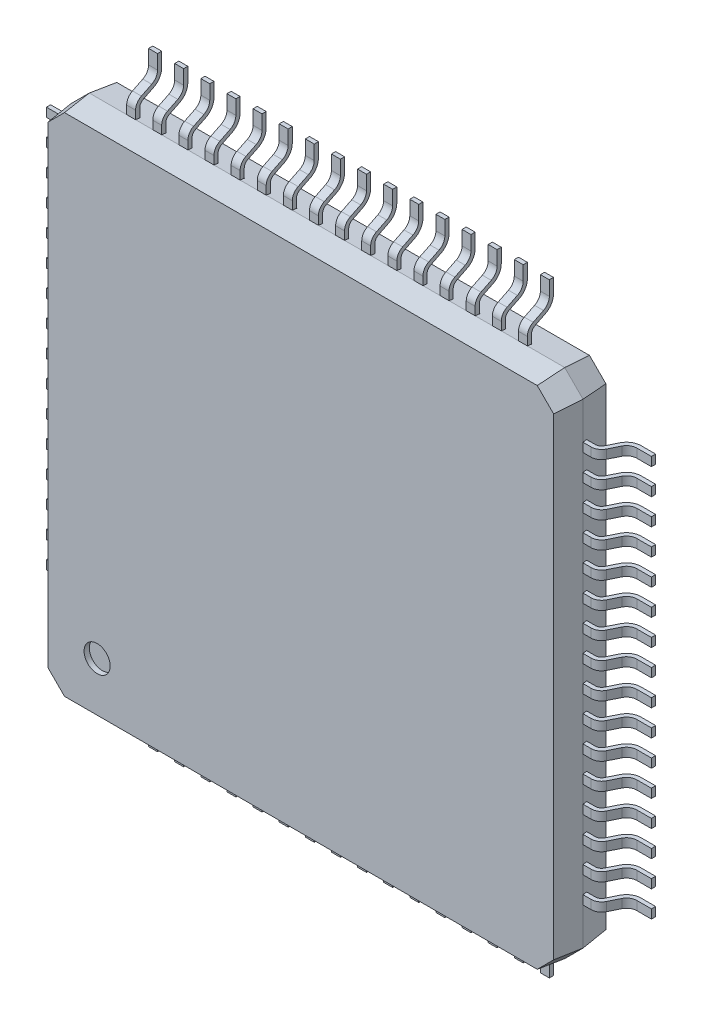
from build123d import *
from OCP.BRepFilletAPI import BRepFilletAPI_MakeChamfer

# Parameters (mm, degrees)
EXTRUDE1_DEPTH    = 1
CHAMFER1_SIZE     = 0.5
CHAMFER1_SIZE2    = 0.06139228
CHAMFER4_SIZE     = 0.06139228
CHAMFER4_SIZE_2   = 0.5
SKETCH2_R         = 0.25
EXTRUDE2_DEPTH    = 0.1
SKETCH4_W         = 0.17077336
SKETCH4_H         = 0.897354233
EXTRUDE3_DEPTH    = 0.5
EXTRUDE3_2_DEPTH  = 0.5
EXTRUDE3_3_DEPTH  = 0.5
EXTRUDE3_4_DEPTH  = 0.5
EXTRUDE3_5_DEPTH  = 0.5
EXTRUDE3_6_DEPTH  = 0.5
EXTRUDE3_7_DEPTH  = 0.5
EXTRUDE3_8_DEPTH  = 0.5
EXTRUDE3_9_DEPTH  = 0.5
EXTRUDE3_10_DEPTH = 0.5
EXTRUDE3_11_DEPTH = 0.5
EXTRUDE3_12_DEPTH = 0.5
EXTRUDE3_13_DEPTH = 0.5
EXTRUDE3_14_DEPTH = 0.5
EXTRUDE3_15_DEPTH = 0.5
SKETCH4_W_2       = 0.90104855
SKETCH4_H_2       = 0.17
EXTRUDE3_16_DEPTH = 0.5
EXTRUDE3_17_DEPTH = 0.5
EXTRUDE3_18_DEPTH = 0.5
EXTRUDE3_19_DEPTH = 0.5
EXTRUDE3_20_DEPTH = 0.5
EXTRUDE3_21_DEPTH = 0.5
EXTRUDE3_22_DEPTH = 0.5
EXTRUDE3_23_DEPTH = 0.5
EXTRUDE3_24_DEPTH = 0.5
EXTRUDE3_25_DEPTH = 0.5
EXTRUDE3_26_DEPTH = 0.5
EXTRUDE3_27_DEPTH = 0.5
EXTRUDE3_28_DEPTH = 0.5
EXTRUDE3_29_DEPTH = 0.5
EXTRUDE3_30_DEPTH = 0.5
EXTRUDE3_31_DEPTH = 0.5
EXTRUDE3_32_DEPTH = 0.5
EXTRUDE3_33_DEPTH = 0.5
EXTRUDE3_34_DEPTH = 0.5
EXTRUDE3_35_DEPTH = 0.5
EXTRUDE3_36_DEPTH = 0.5
EXTRUDE3_37_DEPTH = 0.5
EXTRUDE3_38_DEPTH = 0.5
EXTRUDE3_39_DEPTH = 0.5
EXTRUDE3_40_DEPTH = 0.5
EXTRUDE3_41_DEPTH = 0.5
EXTRUDE3_42_DEPTH = 0.5
EXTRUDE3_43_DEPTH = 0.5
EXTRUDE3_44_DEPTH = 0.5
EXTRUDE3_45_DEPTH = 0.5
EXTRUDE3_46_DEPTH = 0.5
EXTRUDE3_47_DEPTH = 0.5
EXTRUDE3_48_DEPTH = 0.5
EXTRUDE3_49_DEPTH = 0.5
EXTRUDE3_50_DEPTH = 0.5
EXTRUDE3_51_DEPTH = 0.5
EXTRUDE3_52_DEPTH = 0.5
EXTRUDE3_53_DEPTH = 0.5
EXTRUDE3_54_DEPTH = 0.5
EXTRUDE3_55_DEPTH = 0.5
EXTRUDE3_56_DEPTH = 0.5
EXTRUDE3_57_DEPTH = 0.5
EXTRUDE3_58_DEPTH = 0.5
EXTRUDE3_59_DEPTH = 0.5
EXTRUDE3_60_DEPTH = 0.5
EXTRUDE3_61_DEPTH = 0.5
EXTRUDE3_62_DEPTH = 0.5
EXTRUDE3_63_DEPTH = 0.5
EXTRUDE3_64_DEPTH = 0.5
EXTRUDE9_DEPTH    = 12.276959755
EXTRUDE10_DEPTH   = 12.274237102
EXTRUDE11_DEPTH   = 12.276959755
EXTRUDE12_DEPTH   = 12.275731544


with BuildPart() as part:
    # Sketch1 → Extrude1 (new body)
    with BuildSketch(Plane.XY):
        Polygon((-4.55, 4.9), (-4.9, 4.55), (-4.9, -4.55), (-4.55, -4.9), (4.55, -4.9), (4.9, -4.55), (4.9, 4.55), (4.55, 4.9), align=None)
    extrude(amount=EXTRUDE1_DEPTH)

    # Chamfer1: one chamfer whose edges measure the first distance from different faces: ONE call of the kernel's chamfer builder (chamfer() names one face for all edges)
    chamfer1_edges_1 = [part.edges().sort_by_distance(p)[0] for p in [
        (0, -4.9, 1),
    ]]
    chamfer1_side_1 = [part.faces().sort_by_distance(p)[0] for p in [
        (0, -4.9, 0.5),
    ]]
    chamfer1_edges_2 = [part.edges().sort_by_distance(p)[0] for p in [
        (4.725, -4.725, 1),
    ]]
    chamfer1_side_2 = [part.faces().sort_by_distance(p)[0] for p in [
        (4.725, -4.725, 0.5),
    ]]
    chamfer1_edges_3 = [part.edges().sort_by_distance(p)[0] for p in [
        (4.9, 0, 1),
    ]]
    chamfer1_side_3 = [part.faces().sort_by_distance(p)[0] for p in [
        (4.9, 0, 0.5),
    ]]
    chamfer1_edges_4 = [part.edges().sort_by_distance(p)[0] for p in [
        (4.725, 4.725, 1),
    ]]
    chamfer1_side_4 = [part.faces().sort_by_distance(p)[0] for p in [
        (4.725, 4.725, 0.5),
    ]]
    chamfer1_edges_5 = [part.edges().sort_by_distance(p)[0] for p in [
        (0, 4.9, 1),
    ]]
    chamfer1_side_5 = [part.faces().sort_by_distance(p)[0] for p in [
        (0, 4.9, 0.5),
    ]]
    chamfer1_edges_6 = [part.edges().sort_by_distance(p)[0] for p in [
        (-4.725, 4.725, 1),
    ]]
    chamfer1_side_6 = [part.faces().sort_by_distance(p)[0] for p in [
        (-4.725, 4.725, 0.5),
    ]]
    chamfer1_edges_7 = [part.edges().sort_by_distance(p)[0] for p in [
        (-4.9, 0, 1),
    ]]
    chamfer1_side_7 = [part.faces().sort_by_distance(p)[0] for p in [
        (-4.9, 0, 0.5),
    ]]
    chamfer1_edges_8 = [part.edges().sort_by_distance(p)[0] for p in [
        (-4.725, -4.725, 1),
    ]]
    chamfer1_side_8 = [part.faces().sort_by_distance(p)[0] for p in [
        (-4.725, -4.725, 0.5),
    ]]
    chamfer1 = BRepFilletAPI_MakeChamfer(part.part.solid().wrapped)
    for e in chamfer1_edges_1:
        chamfer1.Add(CHAMFER1_SIZE, CHAMFER1_SIZE2, e.wrapped, chamfer1_side_1[0].wrapped)  # the first distance lies on this face
    for e in chamfer1_edges_2:
        chamfer1.Add(CHAMFER1_SIZE, CHAMFER1_SIZE2, e.wrapped, chamfer1_side_2[0].wrapped)  # the first distance lies on this face
    for e in chamfer1_edges_3:
        chamfer1.Add(CHAMFER1_SIZE, CHAMFER1_SIZE2, e.wrapped, chamfer1_side_3[0].wrapped)  # the first distance lies on this face
    for e in chamfer1_edges_4:
        chamfer1.Add(CHAMFER1_SIZE, CHAMFER1_SIZE2, e.wrapped, chamfer1_side_4[0].wrapped)  # the first distance lies on this face
    for e in chamfer1_edges_5:
        chamfer1.Add(CHAMFER1_SIZE, CHAMFER1_SIZE2, e.wrapped, chamfer1_side_5[0].wrapped)  # the first distance lies on this face
    for e in chamfer1_edges_6:
        chamfer1.Add(CHAMFER1_SIZE, CHAMFER1_SIZE2, e.wrapped, chamfer1_side_6[0].wrapped)  # the first distance lies on this face
    for e in chamfer1_edges_7:
        chamfer1.Add(CHAMFER1_SIZE, CHAMFER1_SIZE2, e.wrapped, chamfer1_side_7[0].wrapped)  # the first distance lies on this face
    for e in chamfer1_edges_8:
        chamfer1.Add(CHAMFER1_SIZE, CHAMFER1_SIZE2, e.wrapped, chamfer1_side_8[0].wrapped)  # the first distance lies on this face
    add(Compound.cast(chamfer1.Shape()), mode=Mode.REPLACE)

    # Chamfer4
    # the kernel refuses this chamfer: 0.5, 0.06139228 mm, written as the material it takes off along each edge
    with BuildSketch(Plane(origin=(3.631014617, -5.818985383, 0), x_dir=(-0.6752072893443284, 0.6752072893443284, -0.29696840376135786), z_dir=(0.7071067811865476, 0.7071067811865476, 0)), Plane(origin=(5.818985383, 3.631014617, 0), x_dir=(-0.6752072893443284, -0.6752072893443284, -0.29696840376135786), z_dir=(-0.7071067811865476, 0.7071067811865476, 0)), Plane(origin=(-5.818985383, -3.631014617, 0), x_dir=(0.6752072893443284, 0.6752072893443284, -0.29696840376135786), z_dir=(0.7071067811865476, -0.7071067811865476, 0))) as chamfer4_piece_1:
        Polygon((CHAMFER4_SIZE * 0.954887313026, CHAMFER4_SIZE * 0.296968405945), (-CHAMFER4_SIZE_2 * 0.296968403761, CHAMFER4_SIZE_2 * 0.954887306004), (0, 0), align=None)
    extrude(amount=3.094257932, mode=Mode.SUBTRACT)
    with BuildSketch(Plane(origin=(4.9, -5.849641592, 0), x_dir=(-0.9548873060039249, 0, -0.2969684037613545), z_dir=(0, 1, 0)), Plane(origin=(-5.849641592, -4.9, 0), x_dir=(0, 0.9548873060039249, -0.2969684037613545), z_dir=(1, 0, 0)), Plane(origin=(-4.9, 5.849641592, 0), x_dir=(0.9548873060039249, 0, -0.2969684037613545), z_dir=(0, -1, 0))) as chamfer4_piece_2:
        Polygon((CHAMFER4_SIZE * 0.954887313026, CHAMFER4_SIZE * 0.296968405945), (-CHAMFER4_SIZE_2 * 0.296968403761, CHAMFER4_SIZE_2 * 0.954887306004), (0, 0), align=None)
    extrude(amount=11.699283185, mode=Mode.SUBTRACT)
    with BuildSketch(Plane(origin=(5.849641592, 4.9, 0), x_dir=(0, 0.004688575069791615, 0.9999890085715017), z_dir=(-1, 0, 0))) as chamfer4_piece_3:
        Polygon((CHAMFER4_SIZE_2 * 0.999989008572, -CHAMFER4_SIZE_2 * 0.00468857506979), (-CHAMFER4_SIZE * 0.00468857510427, -CHAMFER4_SIZE * 0.999989015925), (0, 0), align=None)
    extrude(amount=11.699283185, mode=Mode.SUBTRACT)
    with BuildSketch(Plane(origin=(-3.631014617, 5.818985383, 0), x_dir=(-0.0033153232259505567, 0.0033153232259505567, 0.9999890085715017), z_dir=(-0.7071067811865476, -0.7071067811865476, 0))) as chamfer4_piece_4:
        Polygon((CHAMFER4_SIZE_2 * 0.999989008572, -CHAMFER4_SIZE_2 * 0.00468857506979), (-CHAMFER4_SIZE * 0.00468857510427, -CHAMFER4_SIZE * 0.999989015925), (0, 0), align=None)
    extrude(amount=3.094257932, mode=Mode.SUBTRACT)

    # Sketch2 → Extrude2 (cut)
    with BuildSketch(Plane.XY.offset(1)):
        with Locations((-3.9, -3.9)):
            Circle(SKETCH2_R)
    extrude(amount=-EXTRUDE2_DEPTH, mode=Mode.SUBTRACT)


with BuildPart() as body_2:
    # Sketch4 → Extrude3 (new body)
    with BuildSketch(Plane(origin=(0, 0, 0), x_dir=(-1, 0, 0), z_dir=(0, 0, -1))):
        with Locations((-3.25038668, -5.338577123)):
            Rectangle(SKETCH4_W, SKETCH4_H)
    extrude(amount=-EXTRUDE3_DEPTH)


with BuildPart() as body_3:
    # Sketch4 → Extrude3 2 (new body)
    with BuildSketch(Plane(origin=(0, 0, 0), x_dir=(-1, 0, 0), z_dir=(0, 0, -1))):
        with Locations((-2.75038668, -5.338577123)):
            Rectangle(SKETCH4_W, SKETCH4_H)
    extrude(amount=-EXTRUDE3_2_DEPTH)


with BuildPart() as body_4:
    # Sketch4 → Extrude3 3 (new body)
    with BuildSketch(Plane(origin=(0, 0, 0), x_dir=(-1, 0, 0), z_dir=(0, 0, -1))):
        with Locations((-2.25038668, -5.338577123)):
            Rectangle(SKETCH4_W, SKETCH4_H)
    extrude(amount=-EXTRUDE3_3_DEPTH)


with BuildPart() as body_5:
    # Sketch4 → Extrude3 4 (new body)
    with BuildSketch(Plane(origin=(0, 0, 0), x_dir=(-1, 0, 0), z_dir=(0, 0, -1))):
        with Locations((-1.75038668, -5.338577123)):
            Rectangle(SKETCH4_W, SKETCH4_H)
    extrude(amount=-EXTRUDE3_4_DEPTH)


with BuildPart() as body_6:
    # Sketch4 → Extrude3 5 (new body)
    with BuildSketch(Plane(origin=(0, 0, 0), x_dir=(-1, 0, 0), z_dir=(0, 0, -1))):
        with Locations((-1.25038668, -5.338577123)):
            Rectangle(SKETCH4_W, SKETCH4_H)
    extrude(amount=-EXTRUDE3_5_DEPTH)


with BuildPart() as body_7:
    # Sketch4 → Extrude3 6 (new body)
    with BuildSketch(Plane(origin=(0, 0, 0), x_dir=(-1, 0, 0), z_dir=(0, 0, -1))):
        with Locations((-0.75038668, -5.338577123)):
            Rectangle(SKETCH4_W, SKETCH4_H)
    extrude(amount=-EXTRUDE3_6_DEPTH)


with BuildPart() as body_8:
    # Sketch4 → Extrude3 7 (new body)
    with BuildSketch(Plane(origin=(0, 0, 0), x_dir=(-1, 0, 0), z_dir=(0, 0, -1))):
        with Locations((-0.25038668, -5.338577123)):
            Rectangle(SKETCH4_W, SKETCH4_H)
    extrude(amount=-EXTRUDE3_7_DEPTH)


with BuildPart() as body_9:
    # Sketch4 → Extrude3 8 (new body)
    with BuildSketch(Plane(origin=(0, 0, 0), x_dir=(-1, 0, 0), z_dir=(0, 0, -1))):
        with Locations((0.24961332, -5.338577123)):
            Rectangle(SKETCH4_W, SKETCH4_H)
    extrude(amount=-EXTRUDE3_8_DEPTH)


with BuildPart() as body_10:
    # Sketch4 → Extrude3 9 (new body)
    with BuildSketch(Plane(origin=(0, 0, 0), x_dir=(-1, 0, 0), z_dir=(0, 0, -1))):
        with Locations((0.74961332, -5.338577123)):
            Rectangle(SKETCH4_W, SKETCH4_H)
    extrude(amount=-EXTRUDE3_9_DEPTH)


with BuildPart() as body_11:
    # Sketch4 → Extrude3 10 (new body)
    with BuildSketch(Plane(origin=(0, 0, 0), x_dir=(-1, 0, 0), z_dir=(0, 0, -1))):
        with Locations((1.24961332, -5.338577123)):
            Rectangle(SKETCH4_W, SKETCH4_H)
    extrude(amount=-EXTRUDE3_10_DEPTH)


with BuildPart() as body_12:
    # Sketch4 → Extrude3 11 (new body)
    with BuildSketch(Plane(origin=(0, 0, 0), x_dir=(-1, 0, 0), z_dir=(0, 0, -1))):
        with Locations((1.74961332, -5.338577123)):
            Rectangle(SKETCH4_W, SKETCH4_H)
    extrude(amount=-EXTRUDE3_11_DEPTH)


with BuildPart() as body_13:
    # Sketch4 → Extrude3 12 (new body)
    with BuildSketch(Plane(origin=(0, 0, 0), x_dir=(-1, 0, 0), z_dir=(0, 0, -1))):
        with Locations((2.24961332, -5.338577123)):
            Rectangle(SKETCH4_W, SKETCH4_H)
    extrude(amount=-EXTRUDE3_12_DEPTH)


with BuildPart() as body_14:
    # Sketch4 → Extrude3 13 (new body)
    with BuildSketch(Plane(origin=(0, 0, 0), x_dir=(-1, 0, 0), z_dir=(0, 0, -1))):
        with Locations((2.74961332, -5.338577123)):
            Rectangle(SKETCH4_W, SKETCH4_H)
    extrude(amount=-EXTRUDE3_13_DEPTH)


with BuildPart() as body_15:
    # Sketch4 → Extrude3 14 (new body)
    with BuildSketch(Plane(origin=(0, 0, 0), x_dir=(-1, 0, 0), z_dir=(0, 0, -1))):
        with Locations((3.24961332, -5.338577123)):
            Rectangle(SKETCH4_W, SKETCH4_H)
    extrude(amount=-EXTRUDE3_14_DEPTH)


with BuildPart() as body_16:
    # Sketch4 → Extrude3 15 (new body)
    with BuildSketch(Plane(origin=(0, 0, 0), x_dir=(-1, 0, 0), z_dir=(0, 0, -1))):
        with Locations((3.74961332, -5.338577123)):
            Rectangle(SKETCH4_W, SKETCH4_H)
    extrude(amount=-EXTRUDE3_15_DEPTH)


with BuildPart() as body_17:
    # Sketch4 → Extrude3 16 (new body)
    with BuildSketch(Plane(origin=(0, 0, 0), x_dir=(-1, 0, 0), z_dir=(0, 0, -1))):
        with Locations((5.340581475, -3.249093841)):
            Rectangle(SKETCH4_W_2, SKETCH4_H_2)
    extrude(amount=-EXTRUDE3_16_DEPTH)


with BuildPart() as body_18:
    # Sketch4 → Extrude3 17 (new body)
    with BuildSketch(Plane(origin=(0, 0, 0), x_dir=(-1, 0, 0), z_dir=(0, 0, -1))):
        with Locations((-3.75038668, -5.338577123)):
            Rectangle(SKETCH4_W, SKETCH4_H)
    extrude(amount=-EXTRUDE3_17_DEPTH)


with BuildPart() as body_19:
    # Sketch4 → Extrude3 18 (new body)
    with BuildSketch(Plane(origin=(0, 0, 0), x_dir=(-1, 0, 0), z_dir=(0, 0, -1))):
        with Locations((5.340581475, -2.749093841)):
            Rectangle(SKETCH4_W_2, SKETCH4_H_2)
    extrude(amount=-EXTRUDE3_18_DEPTH)


with BuildPart() as body_20:
    # Sketch4 → Extrude3 19 (new body)
    with BuildSketch(Plane(origin=(0, 0, 0), x_dir=(-1, 0, 0), z_dir=(0, 0, -1))):
        with Locations((5.340581475, -2.249093841)):
            Rectangle(SKETCH4_W_2, SKETCH4_H_2)
    extrude(amount=-EXTRUDE3_19_DEPTH)


with BuildPart() as body_21:
    # Sketch4 → Extrude3 20 (new body)
    with BuildSketch(Plane(origin=(0, 0, 0), x_dir=(-1, 0, 0), z_dir=(0, 0, -1))):
        with Locations((5.340581475, -1.749093841)):
            Rectangle(SKETCH4_W_2, SKETCH4_H_2)
    extrude(amount=-EXTRUDE3_20_DEPTH)


with BuildPart() as body_22:
    # Sketch4 → Extrude3 21 (new body)
    with BuildSketch(Plane(origin=(0, 0, 0), x_dir=(-1, 0, 0), z_dir=(0, 0, -1))):
        with Locations((5.340581475, -1.249093841)):
            Rectangle(SKETCH4_W_2, SKETCH4_H_2)
    extrude(amount=-EXTRUDE3_21_DEPTH)


with BuildPart() as body_23:
    # Sketch4 → Extrude3 22 (new body)
    with BuildSketch(Plane(origin=(0, 0, 0), x_dir=(-1, 0, 0), z_dir=(0, 0, -1))):
        with Locations((5.340581475, -0.749093841)):
            Rectangle(SKETCH4_W_2, SKETCH4_H_2)
    extrude(amount=-EXTRUDE3_22_DEPTH)


with BuildPart() as body_24:
    # Sketch4 → Extrude3 23 (new body)
    with BuildSketch(Plane(origin=(0, 0, 0), x_dir=(-1, 0, 0), z_dir=(0, 0, -1))):
        with Locations((5.340581475, -0.249093841)):
            Rectangle(SKETCH4_W_2, SKETCH4_H_2)
    extrude(amount=-EXTRUDE3_23_DEPTH)


with BuildPart() as body_25:
    # Sketch4 → Extrude3 24 (new body)
    with BuildSketch(Plane(origin=(0, 0, 0), x_dir=(-1, 0, 0), z_dir=(0, 0, -1))):
        with Locations((5.340581475, 0.250906159)):
            Rectangle(SKETCH4_W_2, SKETCH4_H_2)
    extrude(amount=-EXTRUDE3_24_DEPTH)


with BuildPart() as body_26:
    # Sketch4 → Extrude3 25 (new body)
    with BuildSketch(Plane(origin=(0, 0, 0), x_dir=(-1, 0, 0), z_dir=(0, 0, -1))):
        with Locations((5.340581475, 0.750906159)):
            Rectangle(SKETCH4_W_2, SKETCH4_H_2)
    extrude(amount=-EXTRUDE3_25_DEPTH)


with BuildPart() as body_27:
    # Sketch4 → Extrude3 26 (new body)
    with BuildSketch(Plane(origin=(0, 0, 0), x_dir=(-1, 0, 0), z_dir=(0, 0, -1))):
        with Locations((5.340581475, 1.250906159)):
            Rectangle(SKETCH4_W_2, SKETCH4_H_2)
    extrude(amount=-EXTRUDE3_26_DEPTH)


with BuildPart() as body_28:
    # Sketch4 → Extrude3 27 (new body)
    with BuildSketch(Plane(origin=(0, 0, 0), x_dir=(-1, 0, 0), z_dir=(0, 0, -1))):
        with Locations((5.340581475, 1.750906159)):
            Rectangle(SKETCH4_W_2, SKETCH4_H_2)
    extrude(amount=-EXTRUDE3_27_DEPTH)


with BuildPart() as body_29:
    # Sketch4 → Extrude3 28 (new body)
    with BuildSketch(Plane(origin=(0, 0, 0), x_dir=(-1, 0, 0), z_dir=(0, 0, -1))):
        with Locations((5.340581475, 2.250906159)):
            Rectangle(SKETCH4_W_2, SKETCH4_H_2)
    extrude(amount=-EXTRUDE3_28_DEPTH)


with BuildPart() as body_30:
    # Sketch4 → Extrude3 29 (new body)
    with BuildSketch(Plane(origin=(0, 0, 0), x_dir=(-1, 0, 0), z_dir=(0, 0, -1))):
        with Locations((5.340581475, 2.750906159)):
            Rectangle(SKETCH4_W_2, SKETCH4_H_2)
    extrude(amount=-EXTRUDE3_29_DEPTH)


with BuildPart() as body_31:
    # Sketch4 → Extrude3 30 (new body)
    with BuildSketch(Plane(origin=(0, 0, 0), x_dir=(-1, 0, 0), z_dir=(0, 0, -1))):
        with Locations((5.340581475, 3.250906159)):
            Rectangle(SKETCH4_W_2, SKETCH4_H_2)
    extrude(amount=-EXTRUDE3_30_DEPTH)


with BuildPart() as body_32:
    # Sketch4 → Extrude3 31 (new body)
    with BuildSketch(Plane(origin=(0, 0, 0), x_dir=(-1, 0, 0), z_dir=(0, 0, -1))):
        with Locations((5.340581475, 3.750906159)):
            Rectangle(SKETCH4_W_2, SKETCH4_H_2)
    extrude(amount=-EXTRUDE3_31_DEPTH)


with BuildPart() as body_33:
    # Sketch4 → Extrude3 32 (new body)
    with BuildSketch(Plane(origin=(0, 0, 0), x_dir=(-1, 0, 0), z_dir=(0, 0, -1))):
        with Locations((-3.25038668, 5.338638318)):
            Rectangle(SKETCH4_W, SKETCH4_H)
    extrude(amount=-EXTRUDE3_32_DEPTH)


with BuildPart() as body_34:
    # Sketch4 → Extrude3 33 (new body)
    with BuildSketch(Plane(origin=(0, 0, 0), x_dir=(-1, 0, 0), z_dir=(0, 0, -1))):
        with Locations((-3.75038668, 5.338638318)):
            Rectangle(SKETCH4_W, SKETCH4_H)
    extrude(amount=-EXTRUDE3_33_DEPTH)


with BuildPart() as body_35:
    # Sketch4 → Extrude3 34 (new body)
    with BuildSketch(Plane(origin=(0, 0, 0), x_dir=(-1, 0, 0), z_dir=(0, 0, -1))):
        with Locations((-2.75038668, 5.338638318)):
            Rectangle(SKETCH4_W, SKETCH4_H)
    extrude(amount=-EXTRUDE3_34_DEPTH)


with BuildPart() as body_36:
    # Sketch4 → Extrude3 35 (new body)
    with BuildSketch(Plane(origin=(0, 0, 0), x_dir=(-1, 0, 0), z_dir=(0, 0, -1))):
        with Locations((-2.25038668, 5.338638318)):
            Rectangle(SKETCH4_W, SKETCH4_H)
    extrude(amount=-EXTRUDE3_35_DEPTH)


with BuildPart() as body_37:
    # Sketch4 → Extrude3 36 (new body)
    with BuildSketch(Plane(origin=(0, 0, 0), x_dir=(-1, 0, 0), z_dir=(0, 0, -1))):
        with Locations((-1.75038668, 5.338638318)):
            Rectangle(SKETCH4_W, SKETCH4_H)
    extrude(amount=-EXTRUDE3_36_DEPTH)


with BuildPart() as body_38:
    # Sketch4 → Extrude3 37 (new body)
    with BuildSketch(Plane(origin=(0, 0, 0), x_dir=(-1, 0, 0), z_dir=(0, 0, -1))):
        with Locations((-1.25038668, 5.338638318)):
            Rectangle(SKETCH4_W, SKETCH4_H)
    extrude(amount=-EXTRUDE3_37_DEPTH)


with BuildPart() as body_39:
    # Sketch4 → Extrude3 38 (new body)
    with BuildSketch(Plane(origin=(0, 0, 0), x_dir=(-1, 0, 0), z_dir=(0, 0, -1))):
        with Locations((-0.75038668, 5.338638318)):
            Rectangle(SKETCH4_W, SKETCH4_H)
    extrude(amount=-EXTRUDE3_38_DEPTH)


with BuildPart() as body_40:
    # Sketch4 → Extrude3 39 (new body)
    with BuildSketch(Plane(origin=(0, 0, 0), x_dir=(-1, 0, 0), z_dir=(0, 0, -1))):
        with Locations((-0.25038668, 5.338638318)):
            Rectangle(SKETCH4_W, SKETCH4_H)
    extrude(amount=-EXTRUDE3_39_DEPTH)


with BuildPart() as body_41:
    # Sketch4 → Extrude3 40 (new body)
    with BuildSketch(Plane(origin=(0, 0, 0), x_dir=(-1, 0, 0), z_dir=(0, 0, -1))):
        with Locations((0.24961332, 5.338638318)):
            Rectangle(SKETCH4_W, SKETCH4_H)
    extrude(amount=-EXTRUDE3_40_DEPTH)


with BuildPart() as body_42:
    # Sketch4 → Extrude3 41 (new body)
    with BuildSketch(Plane(origin=(0, 0, 0), x_dir=(-1, 0, 0), z_dir=(0, 0, -1))):
        with Locations((0.74961332, 5.338638318)):
            Rectangle(SKETCH4_W, SKETCH4_H)
    extrude(amount=-EXTRUDE3_41_DEPTH)


with BuildPart() as body_43:
    # Sketch4 → Extrude3 42 (new body)
    with BuildSketch(Plane(origin=(0, 0, 0), x_dir=(-1, 0, 0), z_dir=(0, 0, -1))):
        with Locations((1.24961332, 5.338638318)):
            Rectangle(SKETCH4_W, SKETCH4_H)
    extrude(amount=-EXTRUDE3_42_DEPTH)


with BuildPart() as body_44:
    # Sketch4 → Extrude3 43 (new body)
    with BuildSketch(Plane(origin=(0, 0, 0), x_dir=(-1, 0, 0), z_dir=(0, 0, -1))):
        with Locations((1.74961332, 5.338638318)):
            Rectangle(SKETCH4_W, SKETCH4_H)
    extrude(amount=-EXTRUDE3_43_DEPTH)


with BuildPart() as body_45:
    # Sketch4 → Extrude3 44 (new body)
    with BuildSketch(Plane(origin=(0, 0, 0), x_dir=(-1, 0, 0), z_dir=(0, 0, -1))):
        with Locations((2.24961332, 5.338638318)):
            Rectangle(SKETCH4_W, SKETCH4_H)
    extrude(amount=-EXTRUDE3_44_DEPTH)


with BuildPart() as body_46:
    # Sketch4 → Extrude3 45 (new body)
    with BuildSketch(Plane(origin=(0, 0, 0), x_dir=(-1, 0, 0), z_dir=(0, 0, -1))):
        with Locations((2.74961332, 5.338638318)):
            Rectangle(SKETCH4_W, SKETCH4_H)
    extrude(amount=-EXTRUDE3_45_DEPTH)


with BuildPart() as body_47:
    # Sketch4 → Extrude3 46 (new body)
    with BuildSketch(Plane(origin=(0, 0, 0), x_dir=(-1, 0, 0), z_dir=(0, 0, -1))):
        with Locations((3.24961332, 5.338638318)):
            Rectangle(SKETCH4_W, SKETCH4_H)
    extrude(amount=-EXTRUDE3_46_DEPTH)


with BuildPart() as body_48:
    # Sketch4 → Extrude3 47 (new body)
    with BuildSketch(Plane(origin=(0, 0, 0), x_dir=(-1, 0, 0), z_dir=(0, 0, -1))):
        with Locations((3.74961332, 5.338638318)):
            Rectangle(SKETCH4_W, SKETCH4_H)
    extrude(amount=-EXTRUDE3_47_DEPTH)


with BuildPart() as body_49:
    # Sketch4 → Extrude3 48 (new body)
    with BuildSketch(Plane(origin=(0, 0, 0), x_dir=(-1, 0, 0), z_dir=(0, 0, -1))):
        with Locations((-5.339418525, -3.249093841)):
            Rectangle(SKETCH4_W_2, SKETCH4_H_2)
    extrude(amount=-EXTRUDE3_48_DEPTH)


with BuildPart() as body_50:
    # Sketch4 → Extrude3 49 (new body)
    with BuildSketch(Plane(origin=(0, 0, 0), x_dir=(-1, 0, 0), z_dir=(0, 0, -1))):
        with Locations((-5.339418525, -2.749093841)):
            Rectangle(SKETCH4_W_2, SKETCH4_H_2)
    extrude(amount=-EXTRUDE3_49_DEPTH)


with BuildPart() as body_51:
    # Sketch4 → Extrude3 50 (new body)
    with BuildSketch(Plane(origin=(0, 0, 0), x_dir=(-1, 0, 0), z_dir=(0, 0, -1))):
        with Locations((5.340581475, -3.749093841)):
            Rectangle(SKETCH4_W_2, SKETCH4_H_2)
    extrude(amount=-EXTRUDE3_50_DEPTH)


with BuildPart() as body_52:
    # Sketch4 → Extrude3 51 (new body)
    with BuildSketch(Plane(origin=(0, 0, 0), x_dir=(-1, 0, 0), z_dir=(0, 0, -1))):
        with Locations((-5.339418525, -2.249093841)):
            Rectangle(SKETCH4_W_2, SKETCH4_H_2)
    extrude(amount=-EXTRUDE3_51_DEPTH)


with BuildPart() as body_53:
    # Sketch4 → Extrude3 52 (new body)
    with BuildSketch(Plane(origin=(0, 0, 0), x_dir=(-1, 0, 0), z_dir=(0, 0, -1))):
        with Locations((-5.339418525, -1.749093841)):
            Rectangle(SKETCH4_W_2, SKETCH4_H_2)
    extrude(amount=-EXTRUDE3_52_DEPTH)


with BuildPart() as body_54:
    # Sketch4 → Extrude3 53 (new body)
    with BuildSketch(Plane(origin=(0, 0, 0), x_dir=(-1, 0, 0), z_dir=(0, 0, -1))):
        with Locations((-5.339418525, -1.249093841)):
            Rectangle(SKETCH4_W_2, SKETCH4_H_2)
    extrude(amount=-EXTRUDE3_53_DEPTH)


with BuildPart() as body_55:
    # Sketch4 → Extrude3 54 (new body)
    with BuildSketch(Plane(origin=(0, 0, 0), x_dir=(-1, 0, 0), z_dir=(0, 0, -1))):
        with Locations((-5.339418525, -0.749093841)):
            Rectangle(SKETCH4_W_2, SKETCH4_H_2)
    extrude(amount=-EXTRUDE3_54_DEPTH)


with BuildPart() as body_56:
    # Sketch4 → Extrude3 55 (new body)
    with BuildSketch(Plane(origin=(0, 0, 0), x_dir=(-1, 0, 0), z_dir=(0, 0, -1))):
        with Locations((-5.339418525, -0.249093841)):
            Rectangle(SKETCH4_W_2, SKETCH4_H_2)
    extrude(amount=-EXTRUDE3_55_DEPTH)


with BuildPart() as body_57:
    # Sketch4 → Extrude3 56 (new body)
    with BuildSketch(Plane(origin=(0, 0, 0), x_dir=(-1, 0, 0), z_dir=(0, 0, -1))):
        with Locations((-5.339418525, 0.250906159)):
            Rectangle(SKETCH4_W_2, SKETCH4_H_2)
    extrude(amount=-EXTRUDE3_56_DEPTH)


with BuildPart() as body_58:
    # Sketch4 → Extrude3 57 (new body)
    with BuildSketch(Plane(origin=(0, 0, 0), x_dir=(-1, 0, 0), z_dir=(0, 0, -1))):
        with Locations((-5.339418525, 0.750906159)):
            Rectangle(SKETCH4_W_2, SKETCH4_H_2)
    extrude(amount=-EXTRUDE3_57_DEPTH)


with BuildPart() as body_59:
    # Sketch4 → Extrude3 58 (new body)
    with BuildSketch(Plane(origin=(0, 0, 0), x_dir=(-1, 0, 0), z_dir=(0, 0, -1))):
        with Locations((-5.339418525, 1.250906159)):
            Rectangle(SKETCH4_W_2, SKETCH4_H_2)
    extrude(amount=-EXTRUDE3_58_DEPTH)


with BuildPart() as body_60:
    # Sketch4 → Extrude3 59 (new body)
    with BuildSketch(Plane(origin=(0, 0, 0), x_dir=(-1, 0, 0), z_dir=(0, 0, -1))):
        with Locations((-5.339418525, 1.750906159)):
            Rectangle(SKETCH4_W_2, SKETCH4_H_2)
    extrude(amount=-EXTRUDE3_59_DEPTH)


with BuildPart() as body_61:
    # Sketch4 → Extrude3 60 (new body)
    with BuildSketch(Plane(origin=(0, 0, 0), x_dir=(-1, 0, 0), z_dir=(0, 0, -1))):
        with Locations((-5.339418525, 2.250906159)):
            Rectangle(SKETCH4_W_2, SKETCH4_H_2)
    extrude(amount=-EXTRUDE3_60_DEPTH)


with BuildPart() as body_62:
    # Sketch4 → Extrude3 61 (new body)
    with BuildSketch(Plane(origin=(0, 0, 0), x_dir=(-1, 0, 0), z_dir=(0, 0, -1))):
        with Locations((-5.339418525, 2.750906159)):
            Rectangle(SKETCH4_W_2, SKETCH4_H_2)
    extrude(amount=-EXTRUDE3_61_DEPTH)


with BuildPart() as body_63:
    # Sketch4 → Extrude3 62 (new body)
    with BuildSketch(Plane(origin=(0, 0, 0), x_dir=(-1, 0, 0), z_dir=(0, 0, -1))):
        with Locations((-5.339418525, 3.250906159)):
            Rectangle(SKETCH4_W_2, SKETCH4_H_2)
    extrude(amount=-EXTRUDE3_62_DEPTH)


with BuildPart() as body_64:
    # Sketch4 → Extrude3 63 (new body)
    with BuildSketch(Plane(origin=(0, 0, 0), x_dir=(-1, 0, 0), z_dir=(0, 0, -1))):
        with Locations((-5.339418525, 3.750906159)):
            Rectangle(SKETCH4_W_2, SKETCH4_H_2)
    extrude(amount=-EXTRUDE3_63_DEPTH)


with BuildPart() as body_65:
    # Sketch4 → Extrude3 64 (new body)
    with BuildSketch(Plane(origin=(0, 0, 0), x_dir=(-1, 0, 0), z_dir=(0, 0, -1))):
        with Locations((-5.339418525, -3.749093841)):
            Rectangle(SKETCH4_W_2, SKETCH4_H_2)
    extrude(amount=-EXTRUDE3_64_DEPTH)


with BuildPart() as extrude9_tool:
    # Sketch14 → Extrude9 (new, through all)
    with BuildSketch(Plane(origin=(3.83577336, 0, 0), x_dir=(0, 0, -1), z_dir=(1, 0, 0))):
        with BuildLine():
            Line((-0.5, -5.05670907), (-0.5, -5.787254239))
            Line((-0.5, -5.787254239), (-0.08, -5.787254239))
            Line((-0.08, -5.787254239), (-0.08, -5.512827776))
            ThreePointArc((-0.08, -5.512827776), (-0.110103233, -5.407304846), (-0.191350887, -5.33354773))
            Line((-0.191350887, -5.33354773), (-0.388649113, -5.235989116))
            ThreePointArc((-0.388649113, -5.235989116), (-0.469896767, -5.162232), (-0.5, -5.05670907))
        make_face()
        with BuildLine():
            Line((-0.155891241, -5.261835712), (-0.353189468, -5.164277098))
            ThreePointArc((-0.353189468, -5.164277098), (-0.40193806, -5.120022828), (-0.42, -5.05670907))
            Line((-0.42, -5.05670907), (-0.42, -4.890177235))
            Line((-0.42, -4.890177235), (-0.412378999, -4.889241494))
            Line((-0.412378999, -4.889241494), (0, -4.889900006))
            Line((0, -4.889900006), (0, -5.512827776))
            ThreePointArc((0, -5.512827776), (-0.042144527, -5.365095674), (-0.155891241, -5.261835712))
        make_face()
    extrude(amount=-EXTRUDE9_DEPTH)


with BuildPart() as body_2_1:
    add(body_2.part)

    # Extrude9: cut by extrude9_tool
    add(extrude9_tool.part, mode=Mode.SUBTRACT)


with BuildPart() as body_3_1:
    add(body_3.part)

    # Extrude9: cut by extrude9_tool
    add(extrude9_tool.part, mode=Mode.SUBTRACT)


with BuildPart() as body_4_1:
    add(body_4.part)

    # Extrude9: cut by extrude9_tool
    add(extrude9_tool.part, mode=Mode.SUBTRACT)


with BuildPart() as body_5_1:
    add(body_5.part)

    # Extrude9: cut by extrude9_tool
    add(extrude9_tool.part, mode=Mode.SUBTRACT)


with BuildPart() as body_6_1:
    add(body_6.part)

    # Extrude9: cut by extrude9_tool
    add(extrude9_tool.part, mode=Mode.SUBTRACT)


with BuildPart() as body_7_1:
    add(body_7.part)

    # Extrude9: cut by extrude9_tool
    add(extrude9_tool.part, mode=Mode.SUBTRACT)


with BuildPart() as body_8_1:
    add(body_8.part)

    # Extrude9: cut by extrude9_tool
    add(extrude9_tool.part, mode=Mode.SUBTRACT)


with BuildPart() as body_9_1:
    add(body_9.part)

    # Extrude9: cut by extrude9_tool
    add(extrude9_tool.part, mode=Mode.SUBTRACT)


with BuildPart() as body_10_1:
    add(body_10.part)

    # Extrude9: cut by extrude9_tool
    add(extrude9_tool.part, mode=Mode.SUBTRACT)


with BuildPart() as body_11_1:
    add(body_11.part)

    # Extrude9: cut by extrude9_tool
    add(extrude9_tool.part, mode=Mode.SUBTRACT)


with BuildPart() as body_12_1:
    add(body_12.part)

    # Extrude9: cut by extrude9_tool
    add(extrude9_tool.part, mode=Mode.SUBTRACT)


with BuildPart() as body_13_1:
    add(body_13.part)

    # Extrude9: cut by extrude9_tool
    add(extrude9_tool.part, mode=Mode.SUBTRACT)


with BuildPart() as body_14_1:
    add(body_14.part)

    # Extrude9: cut by extrude9_tool
    add(extrude9_tool.part, mode=Mode.SUBTRACT)


with BuildPart() as body_15_1:
    add(body_15.part)

    # Extrude9: cut by extrude9_tool
    add(extrude9_tool.part, mode=Mode.SUBTRACT)


with BuildPart() as body_16_1:
    add(body_16.part)

    # Extrude9: cut by extrude9_tool
    add(extrude9_tool.part, mode=Mode.SUBTRACT)


with BuildPart() as body_18_1:
    add(body_18.part)

    # Extrude9: cut by extrude9_tool
    add(extrude9_tool.part, mode=Mode.SUBTRACT)


with BuildPart() as extrude10_tool:
    # Sketch15 → Extrude10 (new, through all)
    with BuildSketch(Plane.XZ.offset(3.834093841)):
        with BuildLine():
            Line((5.05670907, 0.5), (5.7899428, 0.5))
            Line((5.7899428, 0.5), (5.7899428, 0.08))
            Line((5.7899428, 0.08), (5.512827776, 0.08))
            ThreePointArc((5.512827776, 0.08), (5.407304846, 0.110103233), (5.33354773, 0.191350887))
            Line((5.33354773, 0.191350887), (5.235989116, 0.388649113))
            ThreePointArc((5.235989116, 0.388649113), (5.162232, 0.469896767), (5.05670907, 0.5))
        make_face()
        with BuildLine():
            Line((5.05670907, 0.42), (4.890177235, 0.42))
            Line((4.890177235, 0.42), (4.888452454, 0.405952785))
            Line((4.888452454, 0.405952785), (4.88889425, 0))
            Line((4.88889425, 0), (5.512827776, 0))
            ThreePointArc((5.512827776, 0), (5.365095674, 0.042144527), (5.261835712, 0.155891241))
            Line((5.261835712, 0.155891241), (5.164277098, 0.353189468))
            ThreePointArc((5.164277098, 0.353189468), (5.120022828, 0.40193806), (5.05670907, 0.42))
        make_face()
    extrude(amount=-EXTRUDE10_DEPTH)


with BuildPart() as body_49_1:
    add(body_49.part)

    # Extrude10: cut by extrude10_tool
    add(extrude10_tool.part, mode=Mode.SUBTRACT)


with BuildPart() as body_50_1:
    add(body_50.part)

    # Extrude10: cut by extrude10_tool
    add(extrude10_tool.part, mode=Mode.SUBTRACT)


with BuildPart() as body_52_1:
    add(body_52.part)

    # Extrude10: cut by extrude10_tool
    add(extrude10_tool.part, mode=Mode.SUBTRACT)


with BuildPart() as body_53_1:
    add(body_53.part)

    # Extrude10: cut by extrude10_tool
    add(extrude10_tool.part, mode=Mode.SUBTRACT)


with BuildPart() as body_54_1:
    add(body_54.part)

    # Extrude10: cut by extrude10_tool
    add(extrude10_tool.part, mode=Mode.SUBTRACT)


with BuildPart() as body_55_1:
    add(body_55.part)

    # Extrude10: cut by extrude10_tool
    add(extrude10_tool.part, mode=Mode.SUBTRACT)


with BuildPart() as body_56_1:
    add(body_56.part)

    # Extrude10: cut by extrude10_tool
    add(extrude10_tool.part, mode=Mode.SUBTRACT)


with BuildPart() as body_57_1:
    add(body_57.part)

    # Extrude10: cut by extrude10_tool
    add(extrude10_tool.part, mode=Mode.SUBTRACT)


with BuildPart() as body_58_1:
    add(body_58.part)

    # Extrude10: cut by extrude10_tool
    add(extrude10_tool.part, mode=Mode.SUBTRACT)


with BuildPart() as body_59_1:
    add(body_59.part)

    # Extrude10: cut by extrude10_tool
    add(extrude10_tool.part, mode=Mode.SUBTRACT)


with BuildPart() as body_60_1:
    add(body_60.part)

    # Extrude10: cut by extrude10_tool
    add(extrude10_tool.part, mode=Mode.SUBTRACT)


with BuildPart() as body_61_1:
    add(body_61.part)

    # Extrude10: cut by extrude10_tool
    add(extrude10_tool.part, mode=Mode.SUBTRACT)


with BuildPart() as body_62_1:
    add(body_62.part)

    # Extrude10: cut by extrude10_tool
    add(extrude10_tool.part, mode=Mode.SUBTRACT)


with BuildPart() as body_63_1:
    add(body_63.part)

    # Extrude10: cut by extrude10_tool
    add(extrude10_tool.part, mode=Mode.SUBTRACT)


with BuildPart() as body_64_1:
    add(body_64.part)

    # Extrude10: cut by extrude10_tool
    add(extrude10_tool.part, mode=Mode.SUBTRACT)


with BuildPart() as body_65_1:
    add(body_65.part)

    # Extrude10: cut by extrude10_tool
    add(extrude10_tool.part, mode=Mode.SUBTRACT)


with BuildPart() as extrude11_tool:
    # Sketch16 → Extrude11 (new, through all)
    with BuildSketch(Plane(origin=(3.83577336, 0, 0), x_dir=(0, 0, -1), z_dir=(1, 0, 0))):
        with BuildLine():
            Line((-0.5, 5.057776021), (-0.5, 5.79100975))
            Line((-0.5, 5.79100975), (-0.08, 5.79100975))
            Line((-0.08, 5.79100975), (-0.08, 5.513894726))
            ThreePointArc((-0.08, 5.513894726), (-0.110103233, 5.408371797), (-0.191350887, 5.334614681))
            Line((-0.191350887, 5.334614681), (-0.388649113, 5.237056066))
            ThreePointArc((-0.388649113, 5.237056066), (-0.469896767, 5.16329895), (-0.5, 5.057776021))
        make_face()
        with BuildLine():
            Line((-0.42, 5.057776021), (-0.42, 4.891244185))
            Line((-0.42, 4.891244185), (-0.405952785, 4.889519404))
            Line((-0.405952785, 4.889519404), (0, 4.889961201))
            Line((0, 4.889961201), (0, 5.513894726))
            ThreePointArc((0, 5.513894726), (-0.042144527, 5.366162625), (-0.155891241, 5.262902662))
            Line((-0.155891241, 5.262902662), (-0.353189468, 5.165344048))
            ThreePointArc((-0.353189468, 5.165344048), (-0.40193806, 5.121089778), (-0.42, 5.057776021))
        make_face()
    extrude(amount=-EXTRUDE11_DEPTH)


with BuildPart() as body_33_1:
    add(body_33.part)

    # Extrude11: cut by extrude11_tool
    add(extrude11_tool.part, mode=Mode.SUBTRACT)


with BuildPart() as body_34_1:
    add(body_34.part)

    # Extrude11: cut by extrude11_tool
    add(extrude11_tool.part, mode=Mode.SUBTRACT)


with BuildPart() as body_35_1:
    add(body_35.part)

    # Extrude11: cut by extrude11_tool
    add(extrude11_tool.part, mode=Mode.SUBTRACT)


with BuildPart() as body_36_1:
    add(body_36.part)

    # Extrude11: cut by extrude11_tool
    add(extrude11_tool.part, mode=Mode.SUBTRACT)


with BuildPart() as body_37_1:
    add(body_37.part)

    # Extrude11: cut by extrude11_tool
    add(extrude11_tool.part, mode=Mode.SUBTRACT)


with BuildPart() as body_38_1:
    add(body_38.part)

    # Extrude11: cut by extrude11_tool
    add(extrude11_tool.part, mode=Mode.SUBTRACT)


with BuildPart() as body_39_1:
    add(body_39.part)

    # Extrude11: cut by extrude11_tool
    add(extrude11_tool.part, mode=Mode.SUBTRACT)


with BuildPart() as body_40_1:
    add(body_40.part)

    # Extrude11: cut by extrude11_tool
    add(extrude11_tool.part, mode=Mode.SUBTRACT)


with BuildPart() as body_41_1:
    add(body_41.part)

    # Extrude11: cut by extrude11_tool
    add(extrude11_tool.part, mode=Mode.SUBTRACT)


with BuildPart() as body_42_1:
    add(body_42.part)

    # Extrude11: cut by extrude11_tool
    add(extrude11_tool.part, mode=Mode.SUBTRACT)


with BuildPart() as body_43_1:
    add(body_43.part)

    # Extrude11: cut by extrude11_tool
    add(extrude11_tool.part, mode=Mode.SUBTRACT)


with BuildPart() as body_44_1:
    add(body_44.part)

    # Extrude11: cut by extrude11_tool
    add(extrude11_tool.part, mode=Mode.SUBTRACT)


with BuildPart() as body_45_1:
    add(body_45.part)

    # Extrude11: cut by extrude11_tool
    add(extrude11_tool.part, mode=Mode.SUBTRACT)


with BuildPart() as body_46_1:
    add(body_46.part)

    # Extrude11: cut by extrude11_tool
    add(extrude11_tool.part, mode=Mode.SUBTRACT)


with BuildPart() as body_47_1:
    add(body_47.part)

    # Extrude11: cut by extrude11_tool
    add(extrude11_tool.part, mode=Mode.SUBTRACT)


with BuildPart() as body_48_1:
    add(body_48.part)

    # Extrude11: cut by extrude11_tool
    add(extrude11_tool.part, mode=Mode.SUBTRACT)


with BuildPart() as extrude12_tool:
    # Sketch17 → Extrude12 (new, through all)
    with BuildSketch(Plane(origin=(0, 3.835906159, 0), x_dir=(1, 0, 0), z_dir=(0, 1, 0))):
        with BuildLine():
            Line((-5.05787202, -0.5), (-5.79110575, -0.5))
            Line((-5.79110575, -0.5), (-5.79110575, -0.08))
            Line((-5.79110575, -0.08), (-5.513990726, -0.08))
            ThreePointArc((-5.513990726, -0.08), (-5.408467796, -0.110103233), (-5.33471068, -0.191350887))
            Line((-5.33471068, -0.191350887), (-5.237152066, -0.388649113))
            ThreePointArc((-5.237152066, -0.388649113), (-5.16339495, -0.469896767), (-5.05787202, -0.5))
        make_face()
        with BuildLine():
            Line((-5.05787202, -0.42), (-4.891340185, -0.42))
            Line((-4.891340185, -0.42), (-4.889615404, -0.405952785))
            Line((-4.889615404, -0.405952785), (-4.8900572, 0))
            Line((-4.8900572, 0), (-5.513990726, 0))
            ThreePointArc((-5.513990726, 0), (-5.366258624, -0.042144527), (-5.262998662, -0.155891241))
            Line((-5.262998662, -0.155891241), (-5.165440047, -0.353189468))
            ThreePointArc((-5.165440047, -0.353189468), (-5.121185778, -0.40193806), (-5.05787202, -0.42))
        make_face()
    extrude(amount=-EXTRUDE12_DEPTH)


with BuildPart() as body_17_1:
    add(body_17.part)

    # Extrude12: cut by extrude12_tool
    add(extrude12_tool.part, mode=Mode.SUBTRACT)


with BuildPart() as body_19_1:
    add(body_19.part)

    # Extrude12: cut by extrude12_tool
    add(extrude12_tool.part, mode=Mode.SUBTRACT)


with BuildPart() as body_20_1:
    add(body_20.part)

    # Extrude12: cut by extrude12_tool
    add(extrude12_tool.part, mode=Mode.SUBTRACT)


with BuildPart() as body_21_1:
    add(body_21.part)

    # Extrude12: cut by extrude12_tool
    add(extrude12_tool.part, mode=Mode.SUBTRACT)


with BuildPart() as body_22_1:
    add(body_22.part)

    # Extrude12: cut by extrude12_tool
    add(extrude12_tool.part, mode=Mode.SUBTRACT)


with BuildPart() as body_23_1:
    add(body_23.part)

    # Extrude12: cut by extrude12_tool
    add(extrude12_tool.part, mode=Mode.SUBTRACT)


with BuildPart() as body_24_1:
    add(body_24.part)

    # Extrude12: cut by extrude12_tool
    add(extrude12_tool.part, mode=Mode.SUBTRACT)


with BuildPart() as body_25_1:
    add(body_25.part)

    # Extrude12: cut by extrude12_tool
    add(extrude12_tool.part, mode=Mode.SUBTRACT)


with BuildPart() as body_26_1:
    add(body_26.part)

    # Extrude12: cut by extrude12_tool
    add(extrude12_tool.part, mode=Mode.SUBTRACT)


with BuildPart() as body_27_1:
    add(body_27.part)

    # Extrude12: cut by extrude12_tool
    add(extrude12_tool.part, mode=Mode.SUBTRACT)


with BuildPart() as body_28_1:
    add(body_28.part)

    # Extrude12: cut by extrude12_tool
    add(extrude12_tool.part, mode=Mode.SUBTRACT)


with BuildPart() as body_29_1:
    add(body_29.part)

    # Extrude12: cut by extrude12_tool
    add(extrude12_tool.part, mode=Mode.SUBTRACT)


with BuildPart() as body_30_1:
    add(body_30.part)

    # Extrude12: cut by extrude12_tool
    add(extrude12_tool.part, mode=Mode.SUBTRACT)


with BuildPart() as body_31_1:
    add(body_31.part)

    # Extrude12: cut by extrude12_tool
    add(extrude12_tool.part, mode=Mode.SUBTRACT)


with BuildPart() as body_32_1:
    add(body_32.part)

    # Extrude12: cut by extrude12_tool
    add(extrude12_tool.part, mode=Mode.SUBTRACT)


with BuildPart() as body_51_1:
    add(body_51.part)

    # Extrude12: cut by extrude12_tool
    add(extrude12_tool.part, mode=Mode.SUBTRACT)


solid = Compound([part.part, body_2_1.part, body_3_1.part, body_4_1.part, body_5_1.part, body_6_1.part, body_7_1.part, body_8_1.part, body_9_1.part, body_10_1.part, body_11_1.part, body_12_1.part, body_13_1.part, body_14_1.part, body_15_1.part, body_16_1.part, body_18_1.part, body_49_1.part, body_50_1.part, body_52_1.part, body_53_1.part, body_54_1.part, body_55_1.part, body_56_1.part, body_57_1.part, body_58_1.part, body_59_1.part, body_60_1.part, body_61_1.part, body_62_1.part, body_63_1.part, body_64_1.part, body_65_1.part, body_33_1.part, body_34_1.part, body_35_1.part, body_36_1.part, body_37_1.part, body_38_1.part, body_39_1.part, body_40_1.part, body_41_1.part, body_42_1.part, body_43_1.part, body_44_1.part, body_45_1.part, body_46_1.part, body_47_1.part, body_48_1.part, body_17_1.part, body_19_1.part, body_20_1.part, body_21_1.part, body_22_1.part, body_23_1.part, body_24_1.part, body_25_1.part, body_26_1.part, body_27_1.part, body_28_1.part, body_29_1.part, body_30_1.part, body_31_1.part, body_32_1.part, body_51_1.part])
